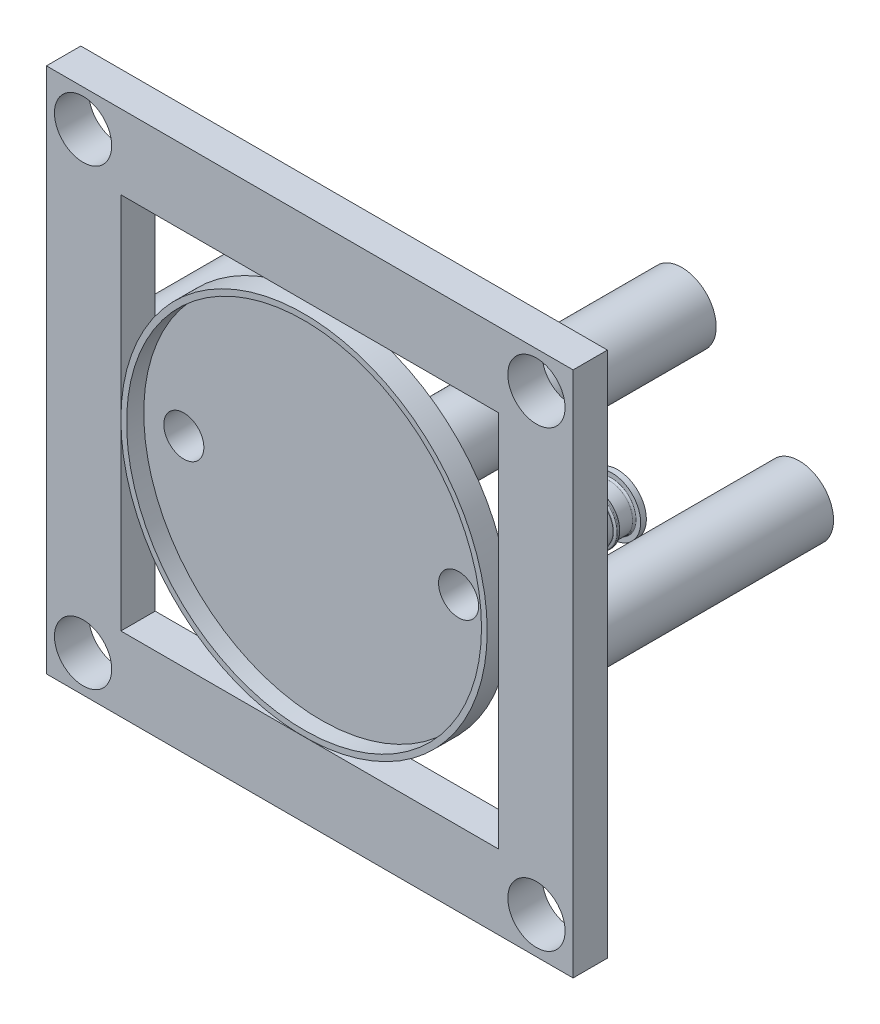
from build123d import *

# Parameters (mm, degrees)
SCHIZZO1_R                         = 16
SCHIZZO1_R_2                       = 15.5
ESTRUSIONE_ESTRUSIONE1_DEPTH       = 1.5
SCHIZZO2_R                         = 16
ESTRUSIONE_ESTRUSIONE2_DEPTH       = 0.5
SCHIZZO6_R                         = 3.5
ESTRUSIONE_ESTRUSIONE4_DEPTH       = 0.5
SCHIZZO7_R                         = 2
ESTRUSIONE_ESTRUSIONE5_DEPTH       = 10.5
SCHIZZO8_R                         = 2.25
ESTRUSIONE_ESTRUSIONE6_DEPTH       = 0.4
SCHIZZO9_R                         = 2
ESTRUSIONE_ESTRUSIONE7_DEPTH       = 2
SCHIZZO10_R                        = 2.5
ESTRUSIONE_ESTRUSIONE8_DEPTH       = 0.5
TAGLIO_ESTRUSIONE5_REACH           = 29.371
SCHIZZO11_R                        = 1.75
RACCORDO2_SIZE                     = 0.1
RACCORDO2_SIZE_2                   = 0.2
RACCORDO3_SIZE                     = 0.2
RACCORDO3_SIZE_2                   = 0.1
RACCORDO4_SIZE                     = 0.2
RACCORDO4_SIZE_2                   = 0.1
RACCORDO5_SIZE                     = 0.1
RACCORDO5_SIZE_2                   = 0.2
RACCORDO6_SIZE                     = 0.1
RACCORDO6_SIZE_2                   = 0.2
SCHIZZO12_R                        = 6
ESTRUSIONE_ESTRUSIONE9_DEPTH       = 1
SCHIZZO13_R                        = 3
ESTRUSIONE_ESTRUSIONE10_DEPTH      = 30
ESTRUSIONE_ESTRUSIONE12_DEPTH      = 1.5
ESTRUSIONE_ESTRUSIONE12_DEPTH_BACK = 1.5
SCHIZZO17_W                        = 46
SCHIZZO17_H                        = 46
SCHIZZO17_W_2                      = 33
SCHIZZO17_H_2                      = 33
SCHIZZO20_W                        = 2.5
SCHIZZO20_H                        = 3.001
RIPETIZIONECIRCOLARE1_COUNT        = 4
SCHIZZO21_R                        = 3
ESTRUSIONE_ESTRUSIONE13_DEPTH      = 20
RACCORDO7_R                        = 0.1
RACCORDO7_OF_SPECCHIA2_R           = 0.1


with BuildPart() as part:
    # Schizzo1 → Estrusione-Estrusione1 (new body)
    with BuildSketch(Plane.XY):
        Circle(SCHIZZO1_R)
        Circle(SCHIZZO1_R_2, mode=Mode.SUBTRACT)
    extrude(amount=-ESTRUSIONE_ESTRUSIONE1_DEPTH)

    # Schizzo2 → Estrusione-Estrusione2 (add)
    with BuildSketch(Plane(origin=(0, 0, -1.5), x_dir=(-1, 0, 0), z_dir=(0, 0, -1))):
        with Locations(Location((0, 0, 0), (0, 0, 180))):
            Circle(SCHIZZO2_R)
    extrude(amount=ESTRUSIONE_ESTRUSIONE2_DEPTH)

    # Schizzo6 → Estrusione-Estrusione4 (add)
    with BuildSketch(Plane(origin=(0, 0, -2), x_dir=(-1, 0, 0), z_dir=(0, 0, -1))):
        with Locations((12, 0)):
            Circle(SCHIZZO6_R)
    extrude(amount=ESTRUSIONE_ESTRUSIONE4_DEPTH)

    # Schizzo7 → Estrusione-Estrusione5 (add)
    with BuildSketch(Plane(origin=(0, 0, -2.5), x_dir=(-1, 0, 0), z_dir=(0, 0, -1))):
        with Locations((12, 0)):
            Circle(SCHIZZO7_R)
    extrude(amount=ESTRUSIONE_ESTRUSIONE5_DEPTH)

    # Schizzo8 → Estrusione-Estrusione6 (add)
    with BuildSketch(Plane(origin=(0, 0, -13), x_dir=(-1, 0, 0), z_dir=(0, 0, -1))):
        with Locations((12, 0)):
            Circle(SCHIZZO8_R)
    extrude(amount=ESTRUSIONE_ESTRUSIONE6_DEPTH)

    # Schizzo9 → Estrusione-Estrusione7 (add)
    with BuildSketch(Plane(origin=(0, 0, -13.4), x_dir=(-1, 0, 0), z_dir=(0, 0, -1))):
        with Locations((12, 0)):
            Circle(SCHIZZO9_R)
    extrude(amount=ESTRUSIONE_ESTRUSIONE7_DEPTH)

    # Schizzo10 → Estrusione-Estrusione8 (add)
    with BuildSketch(Plane(origin=(0, 0, -15.4), x_dir=(-1, 0, 0), z_dir=(0, 0, -1))):
        with Locations((12, 0)):
            Circle(SCHIZZO10_R)
    extrude(amount=-ESTRUSIONE_ESTRUSIONE8_DEPTH)

    # Schizzo11 → Taglio-Estrusione5 (cut, up to next)
    with BuildSketch(Plane(origin=(0, 0, -15.4), x_dir=(-1, 0, 0), z_dir=(0, 0, -1)), mode=Mode.PRIVATE) as taglio_estrusione5_sk1:
        with Locations((12, 0)):
            Circle(SCHIZZO11_R)
    taglio_estrusione5_tool1 = extrude(taglio_estrusione5_sk1.sketch, amount=-TAGLIO_ESTRUSIONE5_REACH, mode=Mode.PRIVATE) & part.part
    add(taglio_estrusione5_tool1.solids().sort_by_distance((-12, 0, -15.4))[0], mode=Mode.SUBTRACT)

    # Raccordo2
    # a fillet whose section is not a circle: 0.2, 0.1 mm, written as the material it takes off along each edge
    with BuildSketch(Plane(origin=(-12, 0, -13), x_dir=(-1, 0, 0), z_dir=(0, -1, 0))) as raccordo2_piece_1:
        with BuildLine():
            Bezier((2.25, RACCORDO2_SIZE), (2.25, 0), (2.25 - RACCORDO2_SIZE_2, 0), weights=[1, 0.707106781, 1])
            Line((2.25 - RACCORDO2_SIZE_2, 0), (2.25, 0))
            Line((2.25, 0), (2.25, RACCORDO2_SIZE))
        make_face()
    revolve(axis=Axis((-12, 0, -13), (0, 0, -1)), mode=Mode.SUBTRACT)

    # Raccordo3
    # a fillet whose section is not a circle: 0.2, 0.1 mm, written as the material it takes off along each edge
    with BuildSketch(Plane(origin=(-12, 0, -13.4), x_dir=(-1, 0, 0), z_dir=(0, -1, 0))) as raccordo3_piece_1:
        with BuildLine():
            Bezier((2.25, -RACCORDO3_SIZE), (2.25, 0), (2.25 - RACCORDO3_SIZE_2, 0), weights=[1, 0.707106781, 1])
            Line((2.25 - RACCORDO3_SIZE_2, 0), (2.15, 0.004))
            Line((2.15, 0.004), (2.254, 0.004))
            Line((2.254, 0.004), (2.254, -0.2))
            Line((2.254, -0.2), (2.25, -RACCORDO3_SIZE))
        make_face()
    revolve(axis=Axis((-12, 0, -13.4), (0, 0, -1)), mode=Mode.SUBTRACT)

    # Raccordo4
    # a fillet whose section is not a circle: 0.2, 0.1 mm, written as the material it adds along each edge
    with BuildSketch(Plane(origin=(-12, 0, -14.9), x_dir=(-1, 0, 0), z_dir=(0, 1, 0))) as raccordo4_piece_1:
        with BuildLine():
            Bezier((2, RACCORDO4_SIZE), (2, 0), (2 + RACCORDO4_SIZE_2, 0), weights=[1, 0.707106781, 1])
            Line((2 + RACCORDO4_SIZE_2, 0), (2, 0))
            Line((2, 0), (2, RACCORDO4_SIZE))
        make_face()
    revolve(axis=Axis((-12, 0, -14.9), (0, 0, 1)))

    # Raccordo5
    # a fillet whose section is not a circle: 0.2, 0.1 mm, written as the material it adds along each edge
    with BuildSketch(Plane(origin=(-12, 0, -2.5), x_dir=(-1, 0, 0), z_dir=(0, -1, 0))) as raccordo5_piece_1:
        with BuildLine():
            Bezier((2, RACCORDO5_SIZE), (2, 0), (2 + RACCORDO5_SIZE_2, 0), weights=[1, 0.707106781, 1])
            Line((2 + RACCORDO5_SIZE_2, 0), (2, 0))
            Line((2, 0), (2, RACCORDO5_SIZE))
        make_face()
    revolve(axis=Axis((-12, 0, -2.5), (0, 0, -1)))

    # Raccordo6
    # a fillet whose section is not a circle: 0.2, 0.1 mm, written as the material it adds along each edge
    with BuildSketch(Plane(origin=(-12, 0, -2), x_dir=(-1, 0, 0), z_dir=(0, -1, 0))) as raccordo6_piece_1:
        with BuildLine():
            Bezier((3.5, RACCORDO6_SIZE), (3.5, 0), (3.5 + RACCORDO6_SIZE_2, 0), weights=[1, 0.707106781, 1])
            Line((3.5 + RACCORDO6_SIZE_2, 0), (3.5, 0))
            Line((3.5, 0), (3.5, RACCORDO6_SIZE))
        make_face()
    revolve(axis=Axis((-12, 0, -2), (0, 0, -1)))

    # Specchia1: read off the stored shape, not the designer's step
    # Specchia1
    split(bisect_by=Plane(origin=(0, 0, 0), x_dir=(0, 0, 1), z_dir=(1, 0, 0)), keep=Keep.BOTTOM)

    # Specchia1 2: part across plane


with BuildPart() as part_1:
    add(part.part)
    add(part.part.mirror(Plane(origin=(0, 0, 0), x_dir=(0, 0, 1), z_dir=(1, 0, 0))))

    # Schizzo12 → Estrusione-Estrusione9 (add)
    with BuildSketch(Plane(origin=(0, 0, -2), x_dir=(-1, 0, 0), z_dir=(0, 0, -1))):
        Circle(SCHIZZO12_R)
    extrude(amount=ESTRUSIONE_ESTRUSIONE9_DEPTH)

    # Schizzo13 → Estrusione-Estrusione10 (add)
    with BuildSketch(Plane(origin=(0, 0, -3), x_dir=(-1, 0, 0), z_dir=(0, 0, -1))):
        Circle(SCHIZZO13_R)
    extrude(amount=ESTRUSIONE_ESTRUSIONE10_DEPTH)


with BuildPart() as body_2:
    # Schizzo17 → Estrusione-Estrusione12 (new, two sides: drawn at the far end of the back side and taken through both)
    with BuildSketch(Plane(origin=(0, 0, -2), x_dir=(-1, 0, 0), z_dir=(0, 0, -1)).offset(-ESTRUSIONE_ESTRUSIONE12_DEPTH_BACK)):
        Rectangle(SCHIZZO17_W, SCHIZZO17_H)
        Rectangle(SCHIZZO17_W_2, SCHIZZO17_H_2, mode=Mode.SUBTRACT)
    extrude(amount=ESTRUSIONE_ESTRUSIONE12_DEPTH + ESTRUSIONE_ESTRUSIONE12_DEPTH_BACK)

    # Schizzo20 → Foro per Vite M1-1 (revolve, cut)
    with BuildSketch(Plane(origin=(19.797979695, 19.8, -3.5), x_dir=(0, 1, 0), z_dir=(1, 0, 0))):
        with Locations((1.25, 1.5005)):
            Rectangle(SCHIZZO20_W, SCHIZZO20_H)
    foro_per_vite_m1_1 = revolve(axis=Axis((19.797979695, 19.8, -9.85), (0, 0, 1)), mode=Mode.SUBTRACT)

    # RipetizioneCircolare1: Foro per Vite M1-1 ×4 about axis
    ripetizionecircolare1_axis = Axis((0, 0, 0), (0, 0, 1))
    for i in range(1, RIPETIZIONECIRCOLARE1_COUNT):
        add(foro_per_vite_m1_1.rotate(ripetizionecircolare1_axis, i * 360 / RIPETIZIONECIRCOLARE1_COUNT), mode=Mode.SUBTRACT)

    # Schizzo21 → Estrusione-Estrusione13 (add)
    with BuildSketch(Plane(origin=(0, 0, -3.5), x_dir=(-1, 0, 0), z_dir=(0, 0, -1))):
        with Locations(Location((-19.75, 0, 0), (0, 0, 180))):
            Circle(SCHIZZO21_R)
    estrusione_estrusione13 = extrude(amount=ESTRUSIONE_ESTRUSIONE13_DEPTH)

    # Raccordo7
    raccordo7_edges = [body_2.edges().sort_by_distance(p)[0] for p in [
        (16.75, 0, -3.5),
    ]]
    fillet(raccordo7_edges, radius=RACCORDO7_R)

    # Specchia2: Estrusione-Estrusione13 across plane
    add(estrusione_estrusione13.mirror(Plane(origin=(0, 0, 0), x_dir=(0, 0, 1), z_dir=(1, 0, 0))))

    # Raccordo7 of Specchia2
    raccordo7_of_specchia2_edges = [body_2.edges().sort_by_distance(p)[0] for p in [
        (-16.75, 0, -3.5),
    ]]
    fillet(raccordo7_of_specchia2_edges, radius=RACCORDO7_OF_SPECCHIA2_R)


solid = Compound([part_1.part, body_2.part])
